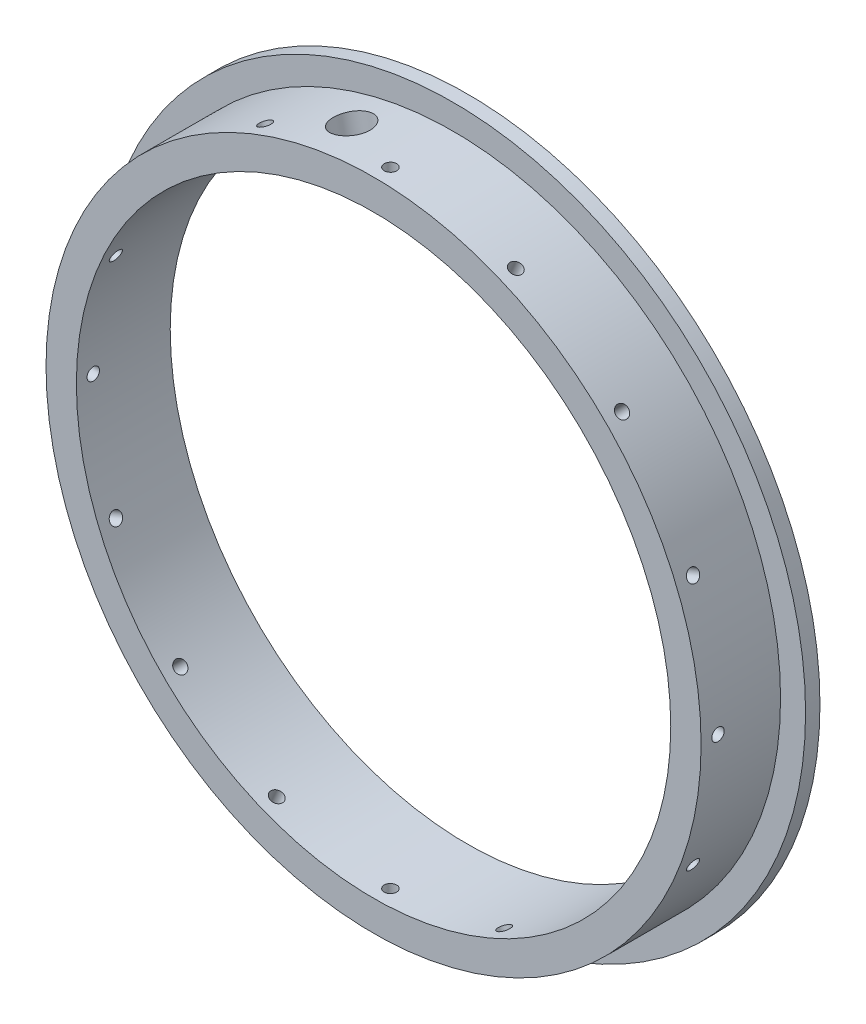
from build123d import *

# Parameters (mm, degrees)
SKETCH1_R         = 71.5645
EXTRUDE1_DEPTH    = 19.05
SKETCH2_R         = 60.325
EXTRUDE2_DEPTH    = 19.05
SKETCH3_OUTSIDE_W = 185.79
SKETCH3_OUTSIDE_H = 185.79
SKETCH3_OUTSIDE_R = 66.4845
EXTRUDE3_DEPTH    = 16.129
CIRPATTERN1_COUNT = 16
SKETCH102_R       = 3.81
EXTRUDE6_DEPTH    = 10.16


with BuildPart() as part:
    # Sketch1 → Extrude1 (new body)
    with BuildSketch(Plane.XY):
        Circle(SKETCH1_R)
    extrude(amount=EXTRUDE1_DEPTH)

    # Sketch2 → Extrude2 (cut)
    with BuildSketch(Plane.XY.offset(19.05)):
        Circle(SKETCH2_R)
    extrude(amount=-EXTRUDE2_DEPTH, mode=Mode.SUBTRACT)

    # Sketch3 outside → Extrude3 (cut)
    with BuildSketch(Plane.XY.offset(19.05)):
        Rectangle(SKETCH3_OUTSIDE_W, SKETCH3_OUTSIDE_H)
        Circle(SKETCH3_OUTSIDE_R, mode=Mode.SUBTRACT)
    extrude(amount=-EXTRUDE3_DEPTH, mode=Mode.SUBTRACT)

    # Sketch41 → #39 (0.0995) Diameter Hole5 (revolve, cut)
    with BuildSketch(Plane(origin=(61.423668779, 25.442516659, 15.621), x_dir=(-0.3826834323651011, 0.9238795325112822, 0), z_dir=(0, 0, 1))):
        Polygon((0, 0), (0, 13.459277521), (1.26365, 12.7), (1.26365, 0), align=None)
    f_39_0_0995_diameter_hole5 = revolve(axis=Axis((67.290303811, 27.872556455, 15.621), (-0.9238795325112822, -0.3826834323651011, 0)), mode=Mode.SUBTRACT)

    # CirPattern1: #39 (0.0995) Diameter Hole5 ×16 about axis
    cirpattern1_axis = Axis((0, 0, 0), (0, 0, 1))
    for i in range(1, CIRPATTERN1_COUNT):
        add(f_39_0_0995_diameter_hole5.rotate(cirpattern1_axis, i * 360 / CIRPATTERN1_COUNT), mode=Mode.SUBTRACT)

    # Sketch102 → Extrude6 (cut)
    with BuildSketch(Plane(origin=(-12.970482514, 65.207018975, 10.541), x_dir=(-0.9807852804032304, -0.19509032201612878, 0), z_dir=(-0.19509032201612878, 0.9807852804032304, 0))):
        Circle(SKETCH102_R)
    extrude(amount=-EXTRUDE6_DEPTH, mode=Mode.SUBTRACT)


solid = part.part
